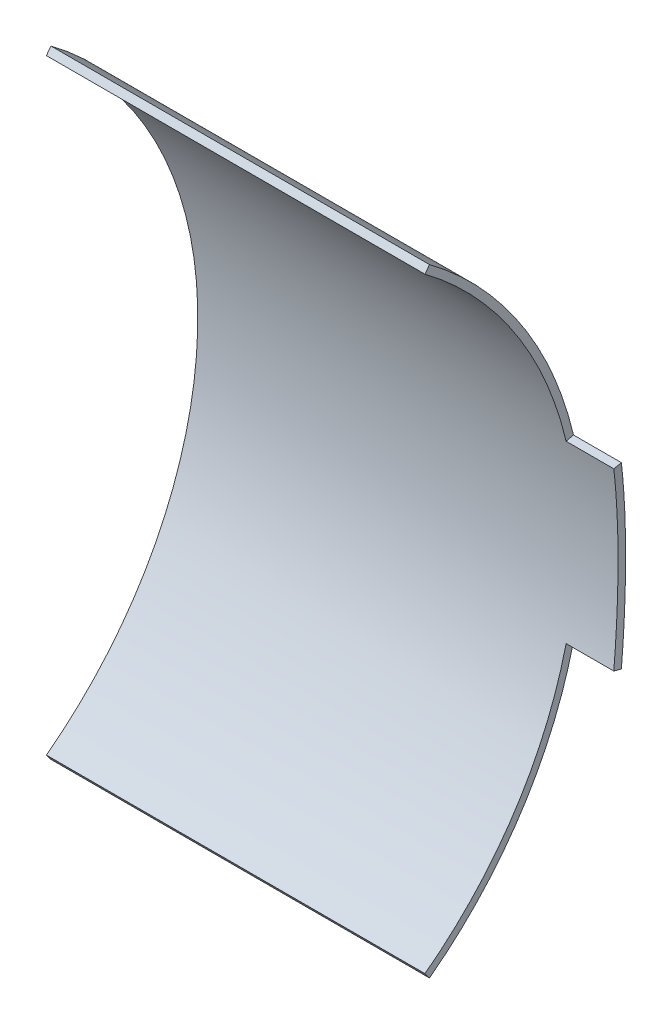
from build123d import *

# Parameters (mm, degrees)
BOSS_EXTRUDE1_DEPTH   = 50
BOSS_EXTRUDE1_2_DEPTH = 50
BOSS_EXTRUDE2_DEPTH   = 55.499654918
BOSS_EXTRUDE2_START   = 55.499654918
BOSS_EXTRUDE2_2_DEPTH = 0.828043858
BOSS_EXTRUDE2_START_2 = -52
BOSS_EXTRUDE2_3_DEPTH = 4


with BuildPart() as part:
    # airflap → Boss-Extrude1 (new body)
    with BuildSketch(Plane(origin=(0, 0, 0), x_dir=(0, 0, -1), z_dir=(1, 0, 0))):
        with BuildLine():
            ThreePointArc((49.615981669, 11.800608587), (42.648471302, 27.966192012), (30.6, 40.8))
            Line((30.6, 40.8), (30, 40))
            ThreePointArc((30, 40), (41.812226766, 27.417835306), (48.643119283, 11.569224105))
            Line((48.643119283, 11.569224105), (49.615981669, 11.800608587))
        make_face()
    extrude(amount=BOSS_EXTRUDE1_DEPTH)



with BuildPart() as body_2:
    # airflap → Boss-Extrude1 2 (new body)
    with BuildSketch(Plane(origin=(0, 0, 0), x_dir=(0, 0, -1), z_dir=(1, 0, 0))):
        with BuildLine():
            ThreePointArc((30.6, -40.8), (42.648471302, -27.966192012), (49.615981669, -11.800608587))
            Line((49.615981669, -11.800608587), (48.643119283, -11.569224105))
            ThreePointArc((48.643119283, -11.569224105), (41.812226766, -27.417835306), (30, -40))
            Line((30, -40), (30.6, -40.8))
        make_face()
    extrude(amount=BOSS_EXTRUDE1_2_DEPTH)


with BuildPart() as part_1:
    add(part.part)

    add(body_2.part)  # Boss-Extrude2 merges body 2
    # Boss-Extrude2: read off the stored shape, not the designer's step
    # Boss-Extrude2 outline → Boss-Extrude2 (add)
    with BuildSketch(Plane(origin=(0, 0, 0), x_dir=(0, 0, -1), z_dir=(1, 0, 0))):
        with BuildLine():
            ThreePointArc((49.615981669, -11.800608587), (51, 0), (49.615981669, 11.800608587))
            Line((49.615981669, 11.800608587), (48.643119283, 11.569224105))
            ThreePointArc((48.643119283, 11.569224105), (50, 0), (48.643119283, -11.569224105))
            Line((48.643119283, -11.569224105), (49.615981669, -11.800608587))
        make_face()
    extrude(amount=BOSS_EXTRUDE2_DEPTH)

    # Boss-Extrude2 2 outline → Boss-Extrude2 2 (add)
    with BuildSketch(Plane.YZ.offset(BOSS_EXTRUDE2_START)):
        with BuildLine():
            Line((11.800608587, -49.615981669), (11.569224105, -48.643119283))
            ThreePointArc((11.569224105, -48.643119283), (0, -50), (-11.569224105, -48.643119283))
            Line((-11.569224105, -48.643119283), (-11.800608587, -49.615981669))
            ThreePointArc((-11.800608587, -49.615981669), (0, -51), (11.800608587, -49.615981669))
        make_face()
    extrude(amount=BOSS_EXTRUDE2_2_DEPTH)

    # Boss-Extrude2 3 outline → Boss-Extrude2 3 (cut)
    with BuildSketch(Plane.XY.offset(BOSS_EXTRUDE2_START_2)):
        with BuildLine():
            ThreePointArc((56.327698776, 11.800608587), (55.499651286, 0), (56.327698776, -11.800608587))
            Line((56.327698776, -11.800608587), (56.327698776, 11.800608587))
        make_face()
    extrude(amount=BOSS_EXTRUDE2_3_DEPTH, mode=Mode.SUBTRACT)


solid = part_1.part
